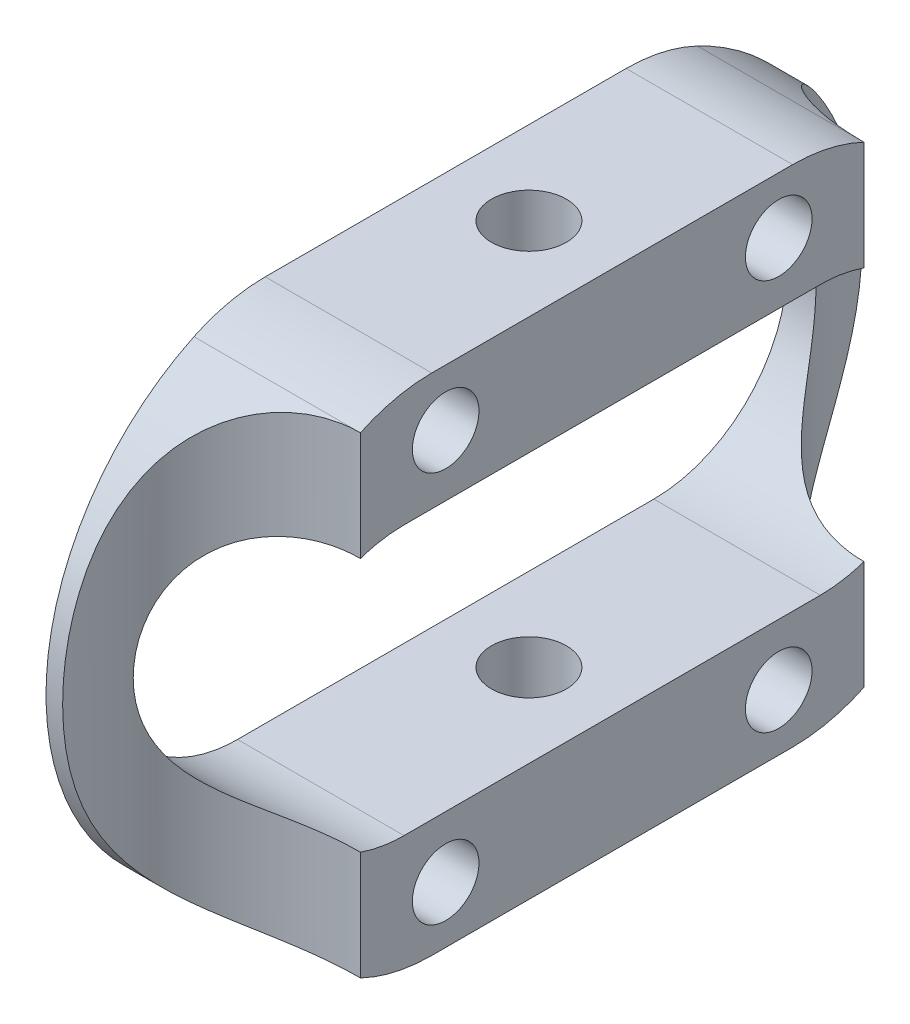
from build123d import *

# Parameters (mm, degrees)
SZKIC1_R                                         = 4
DODANIE_WYCI_GNI_CIE1_DEPTH                      = 20
WYTNIJ_WYCI_GNI_CIE4_DEPTH                       = 80.844262412
WYTNIJ_WYCI_GNI_CIE4_DEPTH_BACK                  = 80.844262412
POG_BIENIE_STO_KOWE_POD_M8_RUB_Z_BEM_D           = 9
POG_BIENIE_STO_KOWE_POD_M8_RUB_Z_BEM_CSINK_D     = 17.3
POG_BIENIE_STO_KOWE_POD_M8_RUB_Z_BEM_CSINK_ANGLE = 90


with BuildPart() as part:
    # Szkic1 → Dodanie-wyciągnięcie1 (new body)
    with BuildSketch(Plane(origin=(0, 0, 0), x_dir=(0, 0, -1), z_dir=(1, 0, 0))):
        with BuildLine():
            add(Edge.make_bspline(
                [(-30.233707808, -28.350561908), (-26.169216525, -30.294827176), (-21.671768561, -30.294827176)],
                knots=[2.699206682, 2.699206682, 2.699206682, 3.141592654, 3.141592654, 3.141592654], degree=2, weights=[1, 0.97563641, 1]))
            Line((-21.671768561, -30.294827176), (21.671768561, -30.294827176))
            add(Edge.make_bspline(
                [(21.671768561, -30.294827176), (26.169216525, -30.294827176), (30.233707808, -28.350561908)],
                knots=[0, 0, 0, 0.442385972, 0.442385972, 0.442385972], degree=2, weights=[1, 0.97563641, 1]))
            add(Edge.make_bspline(
                [(30.233707808, -28.350561908), (89.500626622, 0), (30.233707808, 28.350561908)],
                knots=[0.442385972, 0.442385972, 0.442385972, 2.699206682, 2.699206682, 2.699206682], degree=2, weights=[1, 0.428096962, 1]))
            add(Edge.make_bspline(
                [(30.233707808, 28.350561908), (26.169216525, 30.294827176), (21.671768561, 30.294827176)],
                knots=[2.699206682, 2.699206682, 2.699206682, 3.141592654, 3.141592654, 3.141592654], degree=2, weights=[1, 0.97563641, 1]))
            Line((21.671768561, 30.294827176), (-21.671768561, 30.294827176))
            add(Edge.make_bspline(
                [(-21.671768561, 30.294827176), (-26.169216525, 30.294827176), (-30.233707808, 28.350561908)],
                knots=[3.141592654, 3.141592654, 3.141592654, 3.583978625, 3.583978625, 3.583978625], degree=2, weights=[1, 0.97563641, 1]))
            add(Edge.make_bspline(
                [(-30.233707808, 28.350561908), (-89.500626622, 0), (-30.233707808, -28.350561908)],
                knots=[3.583978625, 3.583978625, 3.583978625, 5.840799336, 5.840799336, 5.840799336], degree=2, weights=[1, 0.428096962, 1]))
        make_face()
        with Locations((-20, -23.5)):
            Circle(SZKIC1_R, mode=Mode.SUBTRACT)
        with Locations((20, -23.5)):
            Circle(SZKIC1_R, mode=Mode.SUBTRACT)
        with Locations((-20, 23.5)):
            Circle(SZKIC1_R, mode=Mode.SUBTRACT)
        with BuildLine():
            add(Edge.make_bspline(
                [(25, -16.15724116), (41, -16.15724116), (41, 0), (41, 16.15724116), (25, 16.15724116)],
                knots=[3.141592654, 3.141592654, 3.141592654, 4.71238898, 4.71238898, 6.283185307, 6.283185307, 6.283185307], degree=2, weights=[1, 0.707106781, 1, 0.707106781, 1]))
            Line((25, -16.15724116), (-25, -16.15724116))
            add(Edge.make_bspline(
                [(-25, 16.15724116), (-41, 16.15724116), (-41, 0), (-41, -16.15724116), (-25, -16.15724116)],
                knots=[0, 0, 0, 1.570796327, 1.570796327, 3.141592654, 3.141592654, 3.141592654], degree=2, weights=[1, 0.707106781, 1, 0.707106781, 1]))
            Line((-25, 16.15724116), (25, 16.15724116))
        make_face(mode=Mode.SUBTRACT)
        with Locations((20, 23.5)):
            Circle(SZKIC1_R, mode=Mode.SUBTRACT)
    extrude(amount=DODANIE_WYCI_GNI_CIE1_DEPTH)

    # Szkic2 → Wytnij-wyciągnięcie4 (cut, two sides: drawn at the far end of the back side and taken through both)
    with BuildSketch(Plane.XZ.offset(30.294827176).offset(-WYTNIJ_WYCI_GNI_CIE4_DEPTH_BACK)):
        with BuildLine():
            Line((2, 48), (2, 49.871745004))
            Line((2, 49.871745004), (22.127967947, 49.871745004))
            Line((22.127967947, 49.871745004), (22.127967947, 30.233707808))
            Line((22.127967947, 30.233707808), (20, 30.233707808))
            ThreePointArc((20, 30.233707808), (7.320480411, 35.388931843), (2, 48))
        make_face()
        with BuildLine():
            Line((22.127967947, -30.233707808), (20, -30.233707808))
            ThreePointArc((20, -30.233707808), (7.320480411, -35.388931843), (2, -48))
            Line((2, -48), (2, -49.871745004))
            Line((2, -49.871745004), (22.127967947, -49.871745004))
            Line((22.127967947, -49.871745004), (22.127967947, -30.233707808))
        make_face()
    extrude(amount=WYTNIJ_WYCI_GNI_CIE4_DEPTH + WYTNIJ_WYCI_GNI_CIE4_DEPTH_BACK, mode=Mode.SUBTRACT)

    # Pogłębienie stożkowe pod M8 Śrubę z łbem soczewkowym1 (through all)
    with Locations(Plane(origin=(10, -30.294827176, 0), x_dir=(0, 0, -1), z_dir=(0, -1, 0))):
        with Locations((0, 0)):
            CounterSinkHole(POG_BIENIE_STO_KOWE_POD_M8_RUB_Z_BEM_D / 2, POG_BIENIE_STO_KOWE_POD_M8_RUB_Z_BEM_CSINK_D / 2, counter_sink_angle=POG_BIENIE_STO_KOWE_POD_M8_RUB_Z_BEM_CSINK_ANGLE)


solid = part.part
